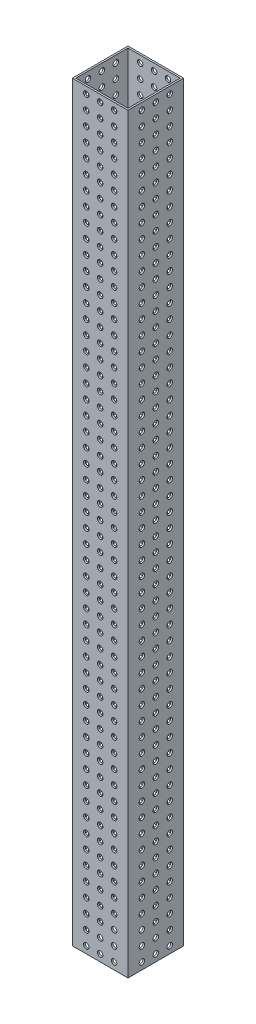
from build123d import *

# Parameters (mm, degrees)
SKETCH1_W           = 50.8
SKETCH1_H           = 50.8
SKETCH1_W_2         = 47.625
SKETCH1_H_2         = 47.625
BOSS_EXTRUDE1_DEPTH = 685.8
SKETCH2_R           = 2.4892
CUT_EXTRUDE1_DEPTH  = 689.147832955
SKETCH4_R           = 2.4892
CUT_EXTRUDE2_DEPTH  = 689.147832955


with BuildPart() as part:
    # Sketch1 → Boss-Extrude1 (new body)
    with BuildSketch(Plane(origin=(0, 0, 0), x_dir=(1, 0, 0), z_dir=(0, 1, 0))):
        Rectangle(SKETCH1_W, SKETCH1_H)
        Rectangle(SKETCH1_W_2, SKETCH1_H_2, mode=Mode.SUBTRACT)
    extrude(amount=BOSS_EXTRUDE1_DEPTH)

    # Sketch2 → Cut-Extrude1 (cut, through all)
    with BuildSketch(Plane.XY.offset(25.4)):
        with Locations((-12.7, 679.45)):
            Circle(SKETCH2_R)
        with Locations((-12.7, 666.75)):
            Circle(SKETCH2_R)
        with Locations((-12.7, 654.05)):
            Circle(SKETCH2_R)
        with Locations((-12.7, 641.35)):
            Circle(SKETCH2_R)
        with Locations((-12.7, 628.65)):
            Circle(SKETCH2_R)
        with Locations((-12.7, 615.95)):
            Circle(SKETCH2_R)
        with Locations((-12.7, 603.25)):
            Circle(SKETCH2_R)
        with Locations((-12.7, 590.55)):
            Circle(SKETCH2_R)
        with Locations((-12.7, 577.85)):
            Circle(SKETCH2_R)
        with Locations((-12.7, 565.15)):
            Circle(SKETCH2_R)
        with Locations((-12.7, 552.45)):
            Circle(SKETCH2_R)
        with Locations((-12.7, 539.75)):
            Circle(SKETCH2_R)
        with Locations((-12.7, 527.05)):
            Circle(SKETCH2_R)
        with Locations((-12.7, 514.35)):
            Circle(SKETCH2_R)
        with Locations((-12.7, 501.65)):
            Circle(SKETCH2_R)
        with Locations((-12.7, 488.95)):
            Circle(SKETCH2_R)
        with Locations((-12.7, 476.25)):
            Circle(SKETCH2_R)
        with Locations((-12.7, 463.55)):
            Circle(SKETCH2_R)
        with Locations((-12.7, 450.85)):
            Circle(SKETCH2_R)
        with Locations((-12.7, 438.15)):
            Circle(SKETCH2_R)
        with Locations((-12.7, 425.45)):
            Circle(SKETCH2_R)
        with Locations((-12.7, 412.75)):
            Circle(SKETCH2_R)
        with Locations((-12.7, 400.05)):
            Circle(SKETCH2_R)
        with Locations((-12.7, 387.35)):
            Circle(SKETCH2_R)
        with Locations((-12.7, 374.65)):
            Circle(SKETCH2_R)
        with Locations((-12.7, 361.95)):
            Circle(SKETCH2_R)
        with Locations((-12.7, 349.25)):
            Circle(SKETCH2_R)
        with Locations((-12.7, 336.55)):
            Circle(SKETCH2_R)
        with Locations((-12.7, 323.85)):
            Circle(SKETCH2_R)
        with Locations((-12.7, 311.15)):
            Circle(SKETCH2_R)
        with Locations((-12.7, 298.45)):
            Circle(SKETCH2_R)
        with Locations((-12.7, 285.75)):
            Circle(SKETCH2_R)
        with Locations((-12.7, 273.05)):
            Circle(SKETCH2_R)
        with Locations((-12.7, 260.35)):
            Circle(SKETCH2_R)
        with Locations((-12.7, 247.65)):
            Circle(SKETCH2_R)
        with Locations((-12.7, 234.95)):
            Circle(SKETCH2_R)
        with Locations((-12.7, 222.25)):
            Circle(SKETCH2_R)
        with Locations((-12.7, 209.55)):
            Circle(SKETCH2_R)
        with Locations((-12.7, 196.85)):
            Circle(SKETCH2_R)
        with Locations((-12.7, 184.15)):
            Circle(SKETCH2_R)
        with Locations((-12.7, 171.45)):
            Circle(SKETCH2_R)
        with Locations((-12.7, 158.75)):
            Circle(SKETCH2_R)
        with Locations((-12.7, 146.05)):
            Circle(SKETCH2_R)
        with Locations((-12.7, 133.35)):
            Circle(SKETCH2_R)
        with Locations((-12.7, 120.65)):
            Circle(SKETCH2_R)
        with Locations((-12.7, 107.95)):
            Circle(SKETCH2_R)
        with Locations((-12.7, 95.25)):
            Circle(SKETCH2_R)
        with Locations((-12.7, 82.55)):
            Circle(SKETCH2_R)
        with Locations((-12.7, 69.85)):
            Circle(SKETCH2_R)
        with Locations((-12.7, 57.15)):
            Circle(SKETCH2_R)
        with Locations((-12.7, 44.45)):
            Circle(SKETCH2_R)
        with Locations((-12.7, 31.75)):
            Circle(SKETCH2_R)
        with Locations((-12.7, 19.05)):
            Circle(SKETCH2_R)
        with Locations((-12.7, 6.35)):
            Circle(SKETCH2_R)
        with Locations((12.7, 6.35)):
            Circle(SKETCH2_R)
        with Locations((12.7, 19.05)):
            Circle(SKETCH2_R)
        with Locations((12.7, 31.75)):
            Circle(SKETCH2_R)
        with Locations((12.7, 44.45)):
            Circle(SKETCH2_R)
        with Locations((12.7, 57.15)):
            Circle(SKETCH2_R)
        with Locations((12.7, 69.85)):
            Circle(SKETCH2_R)
        with Locations((12.7, 82.55)):
            Circle(SKETCH2_R)
        with Locations((12.7, 95.25)):
            Circle(SKETCH2_R)
        with Locations((12.7, 107.95)):
            Circle(SKETCH2_R)
        with Locations((12.7, 120.65)):
            Circle(SKETCH2_R)
        with Locations((12.7, 133.35)):
            Circle(SKETCH2_R)
        with Locations((12.7, 146.05)):
            Circle(SKETCH2_R)
        with Locations((12.7, 158.75)):
            Circle(SKETCH2_R)
        with Locations((12.7, 171.45)):
            Circle(SKETCH2_R)
        with Locations((12.7, 184.15)):
            Circle(SKETCH2_R)
        with Locations((12.7, 196.85)):
            Circle(SKETCH2_R)
        with Locations((12.7, 209.55)):
            Circle(SKETCH2_R)
        with Locations((12.7, 222.25)):
            Circle(SKETCH2_R)
        with Locations((12.7, 234.95)):
            Circle(SKETCH2_R)
        with Locations((12.7, 247.65)):
            Circle(SKETCH2_R)
        with Locations((12.7, 260.35)):
            Circle(SKETCH2_R)
        with Locations((12.7, 273.05)):
            Circle(SKETCH2_R)
        with Locations((12.7, 285.75)):
            Circle(SKETCH2_R)
        with Locations((12.7, 298.45)):
            Circle(SKETCH2_R)
        with Locations((12.7, 311.15)):
            Circle(SKETCH2_R)
        with Locations((12.7, 323.85)):
            Circle(SKETCH2_R)
        with Locations((12.7, 336.55)):
            Circle(SKETCH2_R)
        with Locations((12.7, 374.65)):
            Circle(SKETCH2_R)
        with Locations((12.7, 361.95)):
            Circle(SKETCH2_R)
        with Locations((12.7, 349.25)):
            Circle(SKETCH2_R)
        with Locations((12.7, 387.35)):
            Circle(SKETCH2_R)
        with Locations((12.7, 400.05)):
            Circle(SKETCH2_R)
        with Locations((12.7, 412.75)):
            Circle(SKETCH2_R)
        with Locations((12.7, 425.45)):
            Circle(SKETCH2_R)
        with Locations((12.7, 438.15)):
            Circle(SKETCH2_R)
        with Locations((12.7, 450.85)):
            Circle(SKETCH2_R)
        with Locations((12.7, 463.55)):
            Circle(SKETCH2_R)
        with Locations((12.7, 476.25)):
            Circle(SKETCH2_R)
        with Locations((12.7, 488.95)):
            Circle(SKETCH2_R)
        with Locations((12.7, 501.65)):
            Circle(SKETCH2_R)
        with Locations((12.7, 514.35)):
            Circle(SKETCH2_R)
        with Locations((12.7, 527.05)):
            Circle(SKETCH2_R)
        with Locations((12.7, 539.75)):
            Circle(SKETCH2_R)
        with Locations((12.7, 552.45)):
            Circle(SKETCH2_R)
        with Locations((12.7, 565.15)):
            Circle(SKETCH2_R)
        with Locations((12.7, 577.85)):
            Circle(SKETCH2_R)
        with Locations((12.7, 590.55)):
            Circle(SKETCH2_R)
        with Locations((12.7, 603.25)):
            Circle(SKETCH2_R)
        with Locations((12.7, 615.95)):
            Circle(SKETCH2_R)
        with Locations((12.7, 628.65)):
            Circle(SKETCH2_R)
        with Locations((12.7, 641.35)):
            Circle(SKETCH2_R)
        with Locations((12.7, 654.05)):
            Circle(SKETCH2_R)
        with Locations((12.7, 666.75)):
            Circle(SKETCH2_R)
        with Locations((12.7, 679.45)):
            Circle(SKETCH2_R)
        with Locations((0, 6.35)):
            Circle(SKETCH2_R)
        with Locations((0, 19.05)):
            Circle(SKETCH2_R)
        with Locations((0, 31.75)):
            Circle(SKETCH2_R)
        with Locations((0, 44.45)):
            Circle(SKETCH2_R)
        with Locations((0, 57.15)):
            Circle(SKETCH2_R)
        with Locations((0, 69.85)):
            Circle(SKETCH2_R)
        with Locations((0, 82.55)):
            Circle(SKETCH2_R)
        with Locations((0, 95.25)):
            Circle(SKETCH2_R)
        with Locations((0, 107.95)):
            Circle(SKETCH2_R)
        with Locations((0, 120.65)):
            Circle(SKETCH2_R)
        with Locations((0, 133.35)):
            Circle(SKETCH2_R)
        with Locations((0, 146.05)):
            Circle(SKETCH2_R)
        with Locations((0, 158.75)):
            Circle(SKETCH2_R)
        with Locations((0, 171.45)):
            Circle(SKETCH2_R)
        with Locations((0, 184.15)):
            Circle(SKETCH2_R)
        with Locations((0, 196.85)):
            Circle(SKETCH2_R)
        with Locations((0, 209.55)):
            Circle(SKETCH2_R)
        with Locations((0, 222.25)):
            Circle(SKETCH2_R)
        with Locations((0, 234.95)):
            Circle(SKETCH2_R)
        with Locations((0, 247.65)):
            Circle(SKETCH2_R)
        with Locations((0, 260.35)):
            Circle(SKETCH2_R)
        with Locations((0, 273.05)):
            Circle(SKETCH2_R)
        with Locations((0, 285.75)):
            Circle(SKETCH2_R)
        with Locations((0, 298.45)):
            Circle(SKETCH2_R)
        with Locations((0, 311.15)):
            Circle(SKETCH2_R)
        with Locations((0, 323.85)):
            Circle(SKETCH2_R)
        with Locations((0, 336.55)):
            Circle(SKETCH2_R)
        with Locations((0, 349.25)):
            Circle(SKETCH2_R)
        with Locations((0, 361.95)):
            Circle(SKETCH2_R)
        with Locations((0, 374.65)):
            Circle(SKETCH2_R)
        with Locations((0, 387.35)):
            Circle(SKETCH2_R)
        with Locations((0, 400.05)):
            Circle(SKETCH2_R)
        with Locations((0, 412.75)):
            Circle(SKETCH2_R)
        with Locations((0, 425.45)):
            Circle(SKETCH2_R)
        with Locations((0, 438.15)):
            Circle(SKETCH2_R)
        with Locations((0, 450.85)):
            Circle(SKETCH2_R)
        with Locations((0, 463.55)):
            Circle(SKETCH2_R)
        with Locations((0, 476.25)):
            Circle(SKETCH2_R)
        with Locations((0, 488.95)):
            Circle(SKETCH2_R)
        with Locations((0, 501.65)):
            Circle(SKETCH2_R)
        with Locations((0, 514.35)):
            Circle(SKETCH2_R)
        with Locations((0, 527.05)):
            Circle(SKETCH2_R)
        with Locations((0, 539.75)):
            Circle(SKETCH2_R)
        with Locations((0, 552.45)):
            Circle(SKETCH2_R)
        with Locations((0, 565.15)):
            Circle(SKETCH2_R)
        with Locations((0, 577.85)):
            Circle(SKETCH2_R)
        with Locations((0, 590.55)):
            Circle(SKETCH2_R)
        with Locations((0, 603.25)):
            Circle(SKETCH2_R)
        with Locations((0, 615.95)):
            Circle(SKETCH2_R)
        with Locations((0, 628.65)):
            Circle(SKETCH2_R)
        with Locations((0, 641.35)):
            Circle(SKETCH2_R)
        with Locations((0, 654.05)):
            Circle(SKETCH2_R)
        with Locations((0, 666.75)):
            Circle(SKETCH2_R)
        with Locations((0, 679.45)):
            Circle(SKETCH2_R)
    extrude(amount=-CUT_EXTRUDE1_DEPTH, mode=Mode.SUBTRACT)

    # Sketch4 → Cut-Extrude2 (cut, through all)
    with BuildSketch(Plane(origin=(25.4, 0, 0), x_dir=(0, 0, -1), z_dir=(1, 0, 0))):
        with Locations((-12.7, 679.45)):
            Circle(SKETCH4_R)
        with Locations((-12.7, 666.75)):
            Circle(SKETCH4_R)
        with Locations((-12.7, 654.05)):
            Circle(SKETCH4_R)
        with Locations((-12.7, 641.35)):
            Circle(SKETCH4_R)
        with Locations((-12.7, 628.65)):
            Circle(SKETCH4_R)
        with Locations((-12.7, 615.95)):
            Circle(SKETCH4_R)
        with Locations((-12.7, 603.25)):
            Circle(SKETCH4_R)
        with Locations((-12.7, 590.55)):
            Circle(SKETCH4_R)
        with Locations((-12.7, 577.85)):
            Circle(SKETCH4_R)
        with Locations((-12.7, 565.15)):
            Circle(SKETCH4_R)
        with Locations((-12.7, 552.45)):
            Circle(SKETCH4_R)
        with Locations((-12.7, 539.75)):
            Circle(SKETCH4_R)
        with Locations((-12.7, 527.05)):
            Circle(SKETCH4_R)
        with Locations((-12.7, 514.35)):
            Circle(SKETCH4_R)
        with Locations((-12.7, 501.65)):
            Circle(SKETCH4_R)
        with Locations((-12.7, 488.95)):
            Circle(SKETCH4_R)
        with Locations((-12.7, 476.25)):
            Circle(SKETCH4_R)
        with Locations((-12.7, 463.55)):
            Circle(SKETCH4_R)
        with Locations((-12.7, 450.85)):
            Circle(SKETCH4_R)
        with Locations((-12.7, 438.15)):
            Circle(SKETCH4_R)
        with Locations((-12.7, 425.45)):
            Circle(SKETCH4_R)
        with Locations((-12.7, 412.75)):
            Circle(SKETCH4_R)
        with Locations((-12.7, 400.05)):
            Circle(SKETCH4_R)
        with Locations((-12.7, 387.35)):
            Circle(SKETCH4_R)
        with Locations((-12.7, 374.65)):
            Circle(SKETCH4_R)
        with Locations((-12.7, 361.95)):
            Circle(SKETCH4_R)
        with Locations((-12.7, 349.25)):
            Circle(SKETCH4_R)
        with Locations((-12.7, 336.55)):
            Circle(SKETCH4_R)
        with Locations((-12.7, 323.85)):
            Circle(SKETCH4_R)
        with Locations((-12.7, 311.15)):
            Circle(SKETCH4_R)
        with Locations((-12.7, 298.45)):
            Circle(SKETCH4_R)
        with Locations((-12.7, 285.75)):
            Circle(SKETCH4_R)
        with Locations((-12.7, 273.05)):
            Circle(SKETCH4_R)
        with Locations((-12.7, 260.35)):
            Circle(SKETCH4_R)
        with Locations((-12.7, 247.65)):
            Circle(SKETCH4_R)
        with Locations((-12.7, 234.95)):
            Circle(SKETCH4_R)
        with Locations((-12.7, 222.25)):
            Circle(SKETCH4_R)
        with Locations((-12.7, 209.55)):
            Circle(SKETCH4_R)
        with Locations((-12.7, 196.85)):
            Circle(SKETCH4_R)
        with Locations((-12.7, 184.15)):
            Circle(SKETCH4_R)
        with Locations((-12.7, 171.45)):
            Circle(SKETCH4_R)
        with Locations((-12.7, 158.75)):
            Circle(SKETCH4_R)
        with Locations((-12.7, 146.05)):
            Circle(SKETCH4_R)
        with Locations((-12.7, 133.35)):
            Circle(SKETCH4_R)
        with Locations((-12.7, 120.65)):
            Circle(SKETCH4_R)
        with Locations((-12.7, 107.95)):
            Circle(SKETCH4_R)
        with Locations((-12.7, 95.25)):
            Circle(SKETCH4_R)
        with Locations((-12.7, 82.55)):
            Circle(SKETCH4_R)
        with Locations((-12.7, 69.85)):
            Circle(SKETCH4_R)
        with Locations((-12.7, 57.15)):
            Circle(SKETCH4_R)
        with Locations((-12.7, 44.45)):
            Circle(SKETCH4_R)
        with Locations((-12.7, 31.75)):
            Circle(SKETCH4_R)
        with Locations((-12.7, 19.05)):
            Circle(SKETCH4_R)
        with Locations((-12.7, 6.35)):
            Circle(SKETCH4_R)
        with Locations((12.7, 273.05)):
            Circle(SKETCH4_R)
        with Locations((12.7, 285.75)):
            Circle(SKETCH4_R)
        with Locations((12.7, 298.45)):
            Circle(SKETCH4_R)
        with Locations((12.7, 311.15)):
            Circle(SKETCH4_R)
        with Locations((12.7, 323.85)):
            Circle(SKETCH4_R)
        with Locations((12.7, 336.55)):
            Circle(SKETCH4_R)
        with Locations((12.7, 349.25)):
            Circle(SKETCH4_R)
        with Locations((12.7, 361.95)):
            Circle(SKETCH4_R)
        with Locations((12.7, 374.65)):
            Circle(SKETCH4_R)
        with Locations((12.7, 387.35)):
            Circle(SKETCH4_R)
        with Locations((12.7, 400.05)):
            Circle(SKETCH4_R)
        with Locations((12.7, 412.75)):
            Circle(SKETCH4_R)
        with Locations((12.7, 425.45)):
            Circle(SKETCH4_R)
        with Locations((12.7, 438.15)):
            Circle(SKETCH4_R)
        with Locations((12.7, 450.85)):
            Circle(SKETCH4_R)
        with Locations((12.7, 463.55)):
            Circle(SKETCH4_R)
        with Locations((12.7, 476.25)):
            Circle(SKETCH4_R)
        with Locations((12.7, 488.95)):
            Circle(SKETCH4_R)
        with Locations((12.7, 501.65)):
            Circle(SKETCH4_R)
        with Locations((12.7, 514.35)):
            Circle(SKETCH4_R)
        with Locations((12.7, 527.05)):
            Circle(SKETCH4_R)
        with Locations((12.7, 539.75)):
            Circle(SKETCH4_R)
        with Locations((12.7, 552.45)):
            Circle(SKETCH4_R)
        with Locations((12.7, 565.15)):
            Circle(SKETCH4_R)
        with Locations((12.7, 577.85)):
            Circle(SKETCH4_R)
        with Locations((12.7, 590.55)):
            Circle(SKETCH4_R)
        with Locations((12.7, 603.25)):
            Circle(SKETCH4_R)
        with Locations((12.7, 615.95)):
            Circle(SKETCH4_R)
        with Locations((12.7, 628.65)):
            Circle(SKETCH4_R)
        with Locations((12.7, 641.35)):
            Circle(SKETCH4_R)
        with Locations((12.7, 654.05)):
            Circle(SKETCH4_R)
        with Locations((12.7, 666.75)):
            Circle(SKETCH4_R)
        with Locations((12.7, 19.05)):
            Circle(SKETCH4_R)
        with Locations((12.7, 31.75)):
            Circle(SKETCH4_R)
        with Locations((12.7, 44.45)):
            Circle(SKETCH4_R)
        with Locations((12.7, 57.15)):
            Circle(SKETCH4_R)
        with Locations((12.7, 69.85)):
            Circle(SKETCH4_R)
        with Locations((12.7, 82.55)):
            Circle(SKETCH4_R)
        with Locations((12.7, 95.25)):
            Circle(SKETCH4_R)
        with Locations((12.7, 107.95)):
            Circle(SKETCH4_R)
        with Locations((12.7, 120.65)):
            Circle(SKETCH4_R)
        with Locations((12.7, 133.35)):
            Circle(SKETCH4_R)
        with Locations((12.7, 146.05)):
            Circle(SKETCH4_R)
        with Locations((12.7, 158.75)):
            Circle(SKETCH4_R)
        with Locations((12.7, 171.45)):
            Circle(SKETCH4_R)
        with Locations((12.7, 184.15)):
            Circle(SKETCH4_R)
        with Locations((12.7, 196.85)):
            Circle(SKETCH4_R)
        with Locations((12.7, 209.55)):
            Circle(SKETCH4_R)
        with Locations((12.7, 222.25)):
            Circle(SKETCH4_R)
        with Locations((12.7, 234.95)):
            Circle(SKETCH4_R)
        with Locations((12.7, 247.65)):
            Circle(SKETCH4_R)
        with Locations((12.7, 260.35)):
            Circle(SKETCH4_R)
        with Locations((12.7, 6.35)):
            Circle(SKETCH4_R)
        with Locations((12.7, 679.45)):
            Circle(SKETCH4_R)
        with Locations((0, 82.55)):
            Circle(SKETCH4_R)
        with Locations((0, 19.05)):
            Circle(SKETCH4_R)
        with Locations((0, 31.75)):
            Circle(SKETCH4_R)
        with Locations((0, 44.45)):
            Circle(SKETCH4_R)
        with Locations((0, 57.15)):
            Circle(SKETCH4_R)
        with Locations((0, 69.85)):
            Circle(SKETCH4_R)
        with Locations((0, 95.25)):
            Circle(SKETCH4_R)
        with Locations((0, 107.95)):
            Circle(SKETCH4_R)
        with Locations((0, 120.65)):
            Circle(SKETCH4_R)
        with Locations((0, 133.35)):
            Circle(SKETCH4_R)
        with Locations((0, 146.05)):
            Circle(SKETCH4_R)
        with Locations((0, 158.75)):
            Circle(SKETCH4_R)
        with Locations((0, 171.45)):
            Circle(SKETCH4_R)
        with Locations((0, 184.15)):
            Circle(SKETCH4_R)
        with Locations((0, 196.85)):
            Circle(SKETCH4_R)
        with Locations((0, 209.55)):
            Circle(SKETCH4_R)
        with Locations((0, 222.25)):
            Circle(SKETCH4_R)
        with Locations((0, 234.95)):
            Circle(SKETCH4_R)
        with Locations((0, 247.65)):
            Circle(SKETCH4_R)
        with Locations((0, 260.35)):
            Circle(SKETCH4_R)
        with Locations((0, 273.05)):
            Circle(SKETCH4_R)
        with Locations((0, 285.75)):
            Circle(SKETCH4_R)
        with Locations((0, 298.45)):
            Circle(SKETCH4_R)
        with Locations((0, 311.15)):
            Circle(SKETCH4_R)
        with Locations((0, 323.85)):
            Circle(SKETCH4_R)
        with Locations((0, 336.55)):
            Circle(SKETCH4_R)
        with Locations((0, 361.95)):
            Circle(SKETCH4_R)
        with Locations((0, 374.65)):
            Circle(SKETCH4_R)
        with Locations((0, 387.35)):
            Circle(SKETCH4_R)
        with Locations((0, 400.05)):
            Circle(SKETCH4_R)
        with Locations((0, 412.75)):
            Circle(SKETCH4_R)
        with Locations((0, 425.45)):
            Circle(SKETCH4_R)
        with Locations((0, 438.15)):
            Circle(SKETCH4_R)
        with Locations((0, 450.85)):
            Circle(SKETCH4_R)
        with Locations((0, 463.55)):
            Circle(SKETCH4_R)
        with Locations((0, 476.25)):
            Circle(SKETCH4_R)
        with Locations((0, 488.95)):
            Circle(SKETCH4_R)
        with Locations((0, 501.65)):
            Circle(SKETCH4_R)
        with Locations((0, 514.35)):
            Circle(SKETCH4_R)
        with Locations((0, 527.05)):
            Circle(SKETCH4_R)
        with Locations((0, 539.75)):
            Circle(SKETCH4_R)
        with Locations((0, 552.45)):
            Circle(SKETCH4_R)
        with Locations((0, 565.15)):
            Circle(SKETCH4_R)
        with Locations((0, 577.85)):
            Circle(SKETCH4_R)
        with Locations((0, 590.55)):
            Circle(SKETCH4_R)
        with Locations((0, 603.25)):
            Circle(SKETCH4_R)
        with Locations((0, 615.95)):
            Circle(SKETCH4_R)
        with Locations((0, 628.65)):
            Circle(SKETCH4_R)
        with Locations((0, 641.35)):
            Circle(SKETCH4_R)
        with Locations((0, 654.05)):
            Circle(SKETCH4_R)
        with Locations((0, 666.75)):
            Circle(SKETCH4_R)
        with Locations((0, 679.45)):
            Circle(SKETCH4_R)
        with Locations((0, 349.25)):
            Circle(SKETCH4_R)
        with Locations((0, 6.35)):
            Circle(SKETCH4_R)
    extrude(amount=-CUT_EXTRUDE2_DEPTH, mode=Mode.SUBTRACT)


solid = part.part
